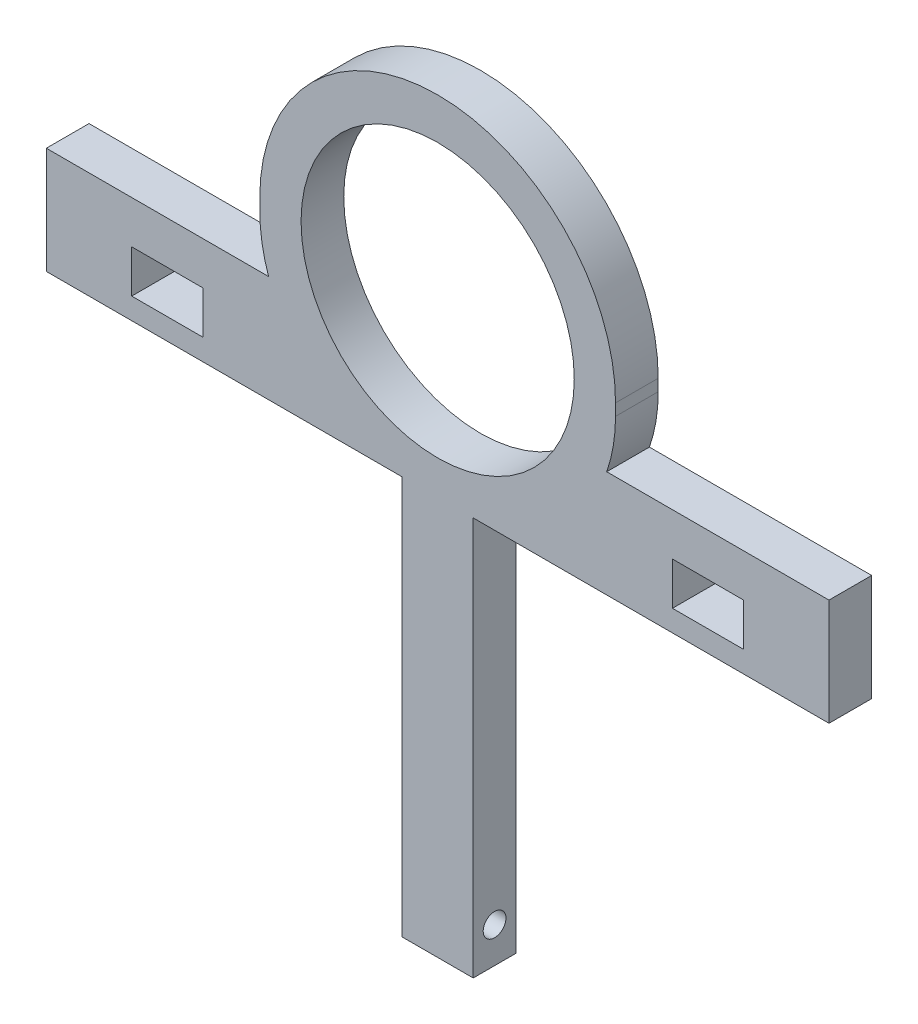
from build123d import *

# Parameters (mm, degrees)
SKETCH1_R           = 31.75
BOSS_EXTRUDE1_DEPTH = 7.62
BOSS_EXTRUDE2_START = -7.62
SKETCH2_W           = 63.5
SKETCH2_H           = 101.6
BOSS_EXTRUDE2_DEPTH = 7.62
SKETCH4_W           = 25.4
SKETCH4_H           = 71.12
CUT_EXTRUDE2_DEPTH  = 107.717790925
FILLET1_R           = 28.575
SKETCH6_W           = 7.62
SKETCH6_H           = 19.05
BOSS_EXTRUDE3_DEPTH = 63.5
SKETCH5_R           = 2.032
CUT_EXTRUDE3_DEPTH  = 128.22839463
SKETCH3_R           = 24.384
CUT_EXTRUDE1_DEPTH  = 7.62
SKETCH7_W           = 12.7
SKETCH7_H           = 7.62
CUT_EXTRUDE4_DEPTH  = 124.529943334


with BuildPart() as part:
    # Sketch1 → Boss-Extrude1 (new body)
    with BuildSketch(Plane.XY):
        with Locations(Location((0, 0, 0), (0, 0, 180))):
            Circle(SKETCH1_R)
    extrude(amount=BOSS_EXTRUDE1_DEPTH)

    # Sketch2 → Boss-Extrude2 (add)
    with BuildSketch(Plane.XY.offset(7.62).offset(BOSS_EXTRUDE2_START)):
        with Locations((0, -50.8)):
            Rectangle(SKETCH2_W, SKETCH2_H)
    extrude(amount=BOSS_EXTRUDE2_DEPTH)

    # Sketch4 → Cut-Extrude2 (cut, through all)
    with BuildSketch(Plane.XY.offset(7.62)):
        with Locations((-19.05, -66.04)):
            Rectangle(SKETCH4_W, SKETCH4_H)
        with Locations((19.05, -66.04)):
            Rectangle(SKETCH4_W, SKETCH4_H)
    extrude(amount=-CUT_EXTRUDE2_DEPTH, mode=Mode.SUBTRACT)

    # Fillet1
    # the kernel refuses this fillet: 28.575 mm, written as the material it takes off along each edge
    with BuildSketch(Plane(origin=(31.75, -30.48, 78.615158286), x_dir=(0, 1, 0), z_dir=(0, 0, -1))) as fillet1_piece_1:
        with BuildLine():
            CenterArc((28.398063314, -28.575), FILLET1_R, 90, 83.620629792)
            Line((0, -25.4), (-0.567961266, -25.3365))
            ThreePointArc((-0.567961266, -25.3365), (-0.5715, -12.7), (-0.5715, 0))
            Line((-0.5715, 0), (0, 0.5715))
            Line((0, 0.5715), (28.398063314, 0.5715))
            Line((28.398063314, 0.5715), (28.398063314, 0))
        make_face()
    extrude(amount=149.610316571, mode=Mode.SUBTRACT)
    with BuildSketch(Plane(origin=(-31.75, -30.48, 78.615158286), x_dir=(1, 0, 0), z_dir=(0, 0, -1))) as fillet1_piece_2:
        with BuildLine():
            CenterArc((28.575, -28.398063314), FILLET1_R, 96.379370208, 83.620629792)
            Line((0, -28.398063314), (-0.5715, -28.398063314))
            Line((-0.5715, -28.398063314), (-0.5715, 0))
            Line((-0.5715, 0), (0, 0.5715))
            ThreePointArc((0, 0.5715), (12.7, 0.5715), (25.3365, 0.567961266))
            Line((25.3365, 0.567961266), (25.4, 0))
        make_face()
    extrude(amount=149.610316571, mode=Mode.SUBTRACT)

    # Sketch6 → Boss-Extrude3 (add)
    with BuildSketch(Plane.ZY.offset(6.35)):
        with Locations((3.81, -20.955)):
            Rectangle(SKETCH6_W, SKETCH6_H)
    boss_extrude3 = extrude(amount=BOSS_EXTRUDE3_DEPTH)

    # Mirror1: Boss-Extrude3 across plane
    add(boss_extrude3.mirror(Plane(origin=(0, 0, 0), x_dir=(0, 0, 1), z_dir=(1, 0, 0))))

    # Sketch5 → Cut-Extrude3 (cut, through all)
    with BuildSketch(Plane.ZY.offset(6.35)):
        with Locations((3.81, -95.25)):
            Circle(SKETCH5_R)
    extrude(amount=-CUT_EXTRUDE3_DEPTH, mode=Mode.SUBTRACT)

    # Sketch3 → Cut-Extrude1 (cut)
    with BuildSketch(Plane.XY.offset(7.62)):
        Circle(SKETCH3_R)
    extrude(amount=-CUT_EXTRUDE1_DEPTH, mode=Mode.SUBTRACT)

    # Sketch7 → Cut-Extrude4 (cut, through all)
    with BuildSketch(Plane.XY.offset(7.62)):
        with Locations((-48.26, -22.86)):
            Rectangle(SKETCH7_W, SKETCH7_H)
    cut_extrude4 = extrude(amount=-CUT_EXTRUDE4_DEPTH, mode=Mode.SUBTRACT)

    # Mirror2: Cut-Extrude4 across plane
    add(cut_extrude4.mirror(Plane(origin=(0, 0, 0), x_dir=(0, 0, 1), z_dir=(1, 0, 0))), mode=Mode.SUBTRACT)


solid = part.part
